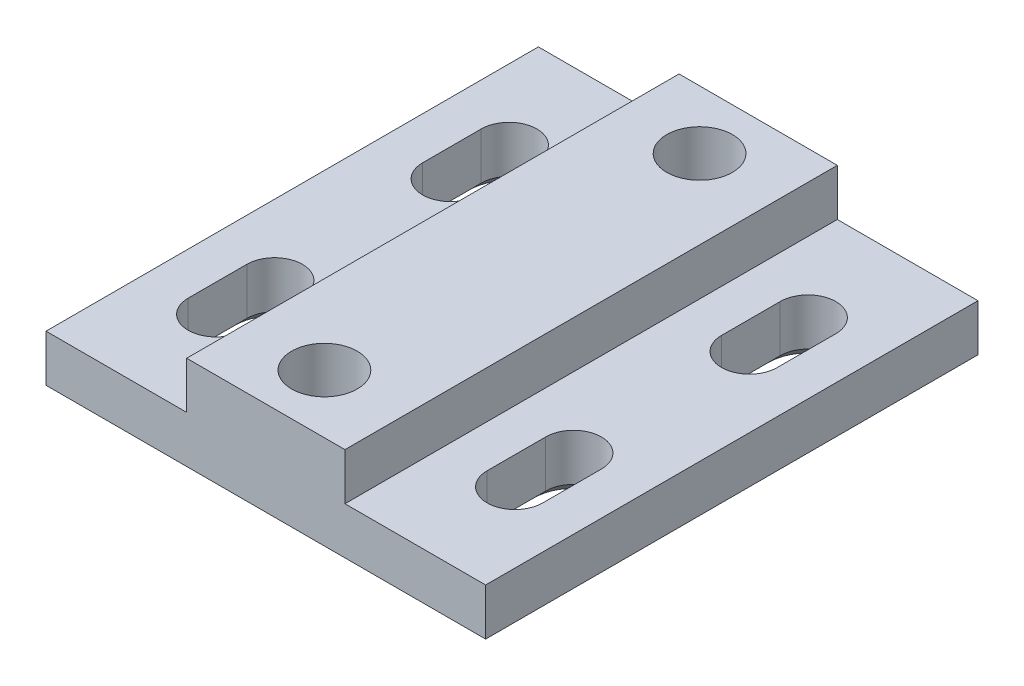
from build123d import *

# Parameters (mm, degrees)
ESBO_O1_W                = 12
ESBO_O1_H                = 42
ESBO_O1_W_2              = 13.5
ESBO_O1_R                = 2.8
RESSALTO_EXTRUS_O1_DEPTH = 5
CORTE_EXTRUS_O1_START    = -5
CORTE_EXTRUS_O1_DEPTH    = 4
RESSALTO_EXTRUS_O2_START = 5
ESBO_O1_3_W              = 13.5
ESBO_O1_3_H              = 42
ESBO_O1_3_R              = 2.8
RESSALTO_EXTRUS_O2_DEPTH = 4


with BuildPart() as part:
    # Esboço1 → Ressalto-extrusão1 (new body)
    # profile 1 of 3: a face of its own
    with BuildSketch(Plane(origin=(0, 0, 0), x_dir=(1, 0, 0), z_dir=(0, 1, 0))):
        with Locations((-12.75, 0)):
            Rectangle(ESBO_O1_W, ESBO_O1_H)
        with BuildLine():
            ThreePointArc((-10.375, -12.5), (-12.75, -14.875), (-15.125, -12.5))
            Line((-15.125, -12.5), (-15.125, -7.5))
            ThreePointArc((-15.125, -7.5), (-12.75, -5.125), (-10.375, -7.5))
            Line((-10.375, -7.5), (-10.375, -12.5))
        make_face(mode=Mode.SUBTRACT)
        with BuildLine():
            ThreePointArc((-10.375, 7.5), (-12.75, 5.125), (-15.125, 7.5))
            Line((-15.125, 7.5), (-15.125, 12.5))
            ThreePointArc((-15.125, 12.5), (-12.75, 14.875), (-10.375, 12.5))
            Line((-10.375, 12.5), (-10.375, 7.5))
        make_face(mode=Mode.SUBTRACT)
    # profile 2 of 3: a face of its own
    with BuildSketch(Plane(origin=(0, 0, 0), x_dir=(1, 0, 0), z_dir=(0, 1, 0))):
        Rectangle(ESBO_O1_W_2, ESBO_O1_H)
        with Locations(Location((0, -16, 0), (0, 0, 270))):
            Circle(ESBO_O1_R, mode=Mode.SUBTRACT)
        with Locations(Location((0, 16, 0), (0, 0, 270))):
            Circle(ESBO_O1_R, mode=Mode.SUBTRACT)
    # profile 3 of 3: a face of its own
    with BuildSketch(Plane(origin=(0, 0, 0), x_dir=(1, 0, 0), z_dir=(0, 1, 0))):
        with Locations((12.75, 0)):
            Rectangle(ESBO_O1_W, ESBO_O1_H)
        with BuildLine():
            Line((15.125, -7.5), (15.125, -12.5))
            ThreePointArc((15.125, -12.5), (12.75, -14.875), (10.375, -12.5))
            Line((10.375, -12.5), (10.375, -7.5))
            ThreePointArc((10.375, -7.5), (12.75, -5.125), (15.125, -7.5))
        make_face(mode=Mode.SUBTRACT)
        with BuildLine():
            Line((15.125, 12.5), (15.125, 7.5))
            ThreePointArc((15.125, 7.5), (12.75, 5.125), (10.375, 7.5))
            Line((10.375, 7.5), (10.375, 12.5))
            ThreePointArc((10.375, 12.5), (12.75, 14.875), (15.125, 12.5))
        make_face(mode=Mode.SUBTRACT)
    extrude(amount=RESSALTO_EXTRUS_O1_DEPTH)

    # Esboço2 → Corte-extrusão1 (cut)
    with BuildSketch(Plane(origin=(0, 5, 0), x_dir=(1, 0, 0), z_dir=(0, 1, 0)).offset(CORTE_EXTRUS_O1_START)):
        Polygon((5.022947342, 16), (2.511473671, 20.35), (-2.511473671, 20.35), (-5.022947342, 16), (-2.511473671, 11.65), (2.511473671, 11.65), align=None)
        Polygon((5.022947342, -16), (2.511473671, -11.65), (-2.511473671, -11.65), (-5.022947342, -16), (-2.511473671, -20.35), (2.511473671, -20.35), align=None)
    extrude(amount=CORTE_EXTRUS_O1_DEPTH, mode=Mode.SUBTRACT)

    # Esboço1<3> → Ressalto-extrusão2 (add)
    with BuildSketch(Plane(origin=(0, 0, 0), x_dir=(1, 0, 0), z_dir=(0, 1, 0)).offset(RESSALTO_EXTRUS_O2_START)):
        Rectangle(ESBO_O1_3_W, ESBO_O1_3_H)
        with Locations(Location((0, -16, 0), (0, 0, 270))):
            Circle(ESBO_O1_3_R, mode=Mode.SUBTRACT)
        with Locations(Location((0, 16, 0), (0, 0, 270))):
            Circle(ESBO_O1_3_R, mode=Mode.SUBTRACT)
    extrude(amount=RESSALTO_EXTRUS_O2_DEPTH)

    # Chanfro1
    # the kernel refuses this chamfer: 1 mm, written as the material it takes off along each edge
    with BuildSketch(Plane(origin=(12.75, 0, -7.5), x_dir=(1, 0, 0), z_dir=(0, 0, -1))) as chanfro1_piece_1:
        with BuildLine():
            Line((2.346715729, -1.028284271), (3.403284271, 0.028284271))
            Line((3.403284271, 0.028284271), (3.403284271, 0.048284271))
            ThreePointArc((3.403284271, 0.048284271), (2.889142136, 0.02), (2.375, 0.02))
            Line((2.375, 0.02), (2.355, 0))
            ThreePointArc((2.355, 0), (2.355, -0.514142136), (2.326715729, -1.028284271))
            Line((2.326715729, -1.028284271), (2.346715729, -1.028284271))
        make_face()
    revolve(axis=Axis((12.75, 0, -7.5), (0, -1, 0)), revolution_arc=180, mode=Mode.SUBTRACT)
    with BuildSketch(Plane(origin=(15.125, 0, -12.5), x_dir=(-0.02749587661058563, 0.9996219169112968, 0), z_dir=(0, 0, 1)), Plane(origin=(10.375, 0, -7.5), x_dir=(0.027495876610585623, 0.9996219169112968, 0), z_dir=(0, 0, -1)), Plane(origin=(15.125, 0, 7.5), x_dir=(-0.02749587661058563, 0.9996219169112968, 0), z_dir=(0, 0, 1)), Plane(origin=(10.375, 0, 12.5), x_dir=(0.02749587661058563, 0.9996219169112968, 0), z_dir=(0, 0, -1)), Plane(origin=(-15.125, 0, -7.5), x_dir=(0.02749587661058563, 0.9996219169112968, 0), z_dir=(0, 0, -1)), Plane(origin=(-10.375, 0, -12.5), x_dir=(-0.02749587661058563, 0.9996219169112968, 0), z_dir=(0, 0, 1)), Plane(origin=(-15.125, 0, 12.5), x_dir=(0.02749587661058563, 0.9996219169112968, 0), z_dir=(0, 0, -1)), Plane(origin=(-10.375, 0, 7.5), x_dir=(-0.02749587661058563, 0.9996219169112968, 0), z_dir=(0, 0, 1))) as chanfro1_piece_2:
        with BuildLine():
            Line((1.028673195, 0), (-0.056547155, -1.027117794))
            Line((-0.056547155, -1.027117794), (-0.076539593, -1.026567876))
            ThreePointArc((-0.076539593, -1.026567876), (-0.034129227, -0.51339783), (-0.019992438, 0.000549918))
            Line((-0.019992438, 0.000549918), (0.000549918, 0.019992438))
            ThreePointArc((0.000549918, 0.019992438), (0.514497665, 0.00585565), (1.029223113, 0.019992438))
            Line((1.029223113, 0.019992438), (1.028673195, 0))
        make_face()
    extrude(amount=5, mode=Mode.SUBTRACT)
    with BuildSketch(Plane(origin=(12.75, 0, -12.5), x_dir=(-1, 0, 0), z_dir=(0, 0, 1))) as chanfro1_piece_3:
        with BuildLine():
            Line((2.346715729, -1.028284271), (3.403284271, 0.028284271))
            Line((3.403284271, 0.028284271), (3.403284271, 0.048284271))
            ThreePointArc((3.403284271, 0.048284271), (2.889142136, 0.02), (2.375, 0.02))
            Line((2.375, 0.02), (2.355, 0))
            ThreePointArc((2.355, 0), (2.355, -0.514142136), (2.326715729, -1.028284271))
            Line((2.326715729, -1.028284271), (2.346715729, -1.028284271))
        make_face()
    revolve(axis=Axis((12.75, 0, -12.5), (0, -1, 0)), revolution_arc=180, mode=Mode.SUBTRACT)
    with BuildSketch(Plane(origin=(12.75, 0, 12.5), x_dir=(1, 0, 0), z_dir=(0, 0, -1))) as chanfro1_piece_4:
        with BuildLine():
            Line((2.346715729, -1.028284271), (3.403284271, 0.028284271))
            Line((3.403284271, 0.028284271), (3.403284271, 0.048284271))
            ThreePointArc((3.403284271, 0.048284271), (2.889142136, 0.02), (2.375, 0.02))
            Line((2.375, 0.02), (2.355, 0))
            ThreePointArc((2.355, 0), (2.355, -0.514142136), (2.326715729, -1.028284271))
            Line((2.326715729, -1.028284271), (2.346715729, -1.028284271))
        make_face()
    revolve(axis=Axis((12.75, 0, 12.5), (0, -1, 0)), revolution_arc=180, mode=Mode.SUBTRACT)
    with BuildSketch(Plane(origin=(12.75, 0, 7.5), x_dir=(-1, 0, 0), z_dir=(0, 0, 1))) as chanfro1_piece_5:
        with BuildLine():
            Line((2.346715729, -1.028284271), (3.403284271, 0.028284271))
            Line((3.403284271, 0.028284271), (3.403284271, 0.048284271))
            ThreePointArc((3.403284271, 0.048284271), (2.889142136, 0.02), (2.375, 0.02))
            Line((2.375, 0.02), (2.355, 0))
            ThreePointArc((2.355, 0), (2.355, -0.514142136), (2.326715729, -1.028284271))
            Line((2.326715729, -1.028284271), (2.346715729, -1.028284271))
        make_face()
    revolve(axis=Axis((12.75, 0, 7.5), (0, -1, 0)), revolution_arc=180, mode=Mode.SUBTRACT)
    with BuildSketch(Plane(origin=(-18.75, 0, -21), x_dir=(0.9996219169112968, -0.02749587661058639, 0), z_dir=(0, 0, 1))) as chanfro1_piece_6:
        with BuildLine():
            Line((1.028673195, 0), (-0.056547155, 1.027117794))
            Line((-0.056547155, 1.027117794), (-0.076539593, 1.026567876))
            ThreePointArc((-0.076539593, 1.026567876), (-0.034129227, 0.51339783), (-0.019992438, -0.000549918))
            Line((-0.019992438, -0.000549918), (0.000549918, -0.019992438))
            ThreePointArc((0.000549918, -0.019992438), (0.514497665, -0.00585565), (1.029223113, -0.019992438))
            Line((1.029223113, -0.019992438), (1.028673195, 0))
        make_face()
    extrude(amount=42, mode=Mode.SUBTRACT)
    with BuildSketch(Plane(origin=(18.75, 0, -21), x_dir=(0, 0.9996219169112968, -0.02749587661058908), z_dir=(-1, 0, 0))) as chanfro1_piece_7:
        with BuildLine():
            Line((1.028673195, 0), (-0.056547155, -1.027117794))
            Line((-0.056547155, -1.027117794), (-0.076539593, -1.026567876))
            ThreePointArc((-0.076539593, -1.026567876), (-0.034129227, -0.51339783), (-0.019992438, 0.000549918))
            Line((-0.019992438, 0.000549918), (0.000549918, 0.019992438))
            ThreePointArc((0.000549918, 0.019992438), (0.514497665, 0.00585565), (1.029223113, 0.019992438))
            Line((1.029223113, 0.019992438), (1.028673195, 0))
        make_face()
    extrude(amount=37.5, mode=Mode.SUBTRACT)
    with BuildSketch(Plane(origin=(18.75, 0, 21), x_dir=(0.02749587661058563, 0.9996219169112968, 0), z_dir=(0, 0, -1))) as chanfro1_piece_8:
        with BuildLine():
            Line((1.028673195, 0), (-0.056547155, -1.027117794))
            Line((-0.056547155, -1.027117794), (-0.076539593, -1.026567876))
            ThreePointArc((-0.076539593, -1.026567876), (-0.034129227, -0.51339783), (-0.019992438, 0.000549918))
            Line((-0.019992438, 0.000549918), (0.000549918, 0.019992438))
            ThreePointArc((0.000549918, 0.019992438), (0.514497665, 0.00585565), (1.029223113, 0.019992438))
            Line((1.029223113, 0.019992438), (1.028673195, 0))
        make_face()
    extrude(amount=42, mode=Mode.SUBTRACT)
    with BuildSketch(Plane(origin=(18.75, 0, 21), x_dir=(0, 0.9996219169112968, 0.02749587661058908), z_dir=(-1, 0, 0))) as chanfro1_piece_9:
        with BuildLine():
            Line((1.028673195, 0), (-0.056547155, 1.027117794))
            Line((-0.056547155, 1.027117794), (-0.076539593, 1.026567876))
            ThreePointArc((-0.076539593, 1.026567876), (-0.034129227, 0.51339783), (-0.019992438, -0.000549918))
            Line((-0.019992438, -0.000549918), (0.000549918, -0.019992438))
            ThreePointArc((0.000549918, -0.019992438), (0.514497665, -0.00585565), (1.029223113, -0.019992438))
            Line((1.029223113, -0.019992438), (1.028673195, 0))
        make_face()
    extrude(amount=37.5, mode=Mode.SUBTRACT)
    with BuildSketch(Plane(origin=(-12.75, 0, -7.5), x_dir=(1, 0, 0), z_dir=(0, 0, -1))) as chanfro1_piece_10:
        with BuildLine():
            Line((2.346715729, -1.028284271), (3.403284271, 0.028284271))
            Line((3.403284271, 0.028284271), (3.403284271, 0.048284271))
            ThreePointArc((3.403284271, 0.048284271), (2.889142136, 0.02), (2.375, 0.02))
            Line((2.375, 0.02), (2.355, 0))
            ThreePointArc((2.355, 0), (2.355, -0.514142136), (2.326715729, -1.028284271))
            Line((2.326715729, -1.028284271), (2.346715729, -1.028284271))
        make_face()
    revolve(axis=Axis((-12.75, 0, -7.5), (0, -1, 0)), revolution_arc=180, mode=Mode.SUBTRACT)
    with BuildSketch(Plane(origin=(-12.75, 0, -12.5), x_dir=(-1, 0, 0), z_dir=(0, 0, 1))) as chanfro1_piece_11:
        with BuildLine():
            Line((2.346715729, -1.028284271), (3.403284271, 0.028284271))
            Line((3.403284271, 0.028284271), (3.403284271, 0.048284271))
            ThreePointArc((3.403284271, 0.048284271), (2.889142136, 0.02), (2.375, 0.02))
            Line((2.375, 0.02), (2.355, 0))
            ThreePointArc((2.355, 0), (2.355, -0.514142136), (2.326715729, -1.028284271))
            Line((2.326715729, -1.028284271), (2.346715729, -1.028284271))
        make_face()
    revolve(axis=Axis((-12.75, 0, -12.5), (0, -1, 0)), revolution_arc=180, mode=Mode.SUBTRACT)
    with BuildSketch(Plane(origin=(-12.75, 0, 12.5), x_dir=(1, 0, 0), z_dir=(0, 0, -1))) as chanfro1_piece_12:
        with BuildLine():
            Line((2.346715729, -1.028284271), (3.403284271, 0.028284271))
            Line((3.403284271, 0.028284271), (3.403284271, 0.048284271))
            ThreePointArc((3.403284271, 0.048284271), (2.889142136, 0.02), (2.375, 0.02))
            Line((2.375, 0.02), (2.355, 0))
            ThreePointArc((2.355, 0), (2.355, -0.514142136), (2.326715729, -1.028284271))
            Line((2.326715729, -1.028284271), (2.346715729, -1.028284271))
        make_face()
    revolve(axis=Axis((-12.75, 0, 12.5), (0, -1, 0)), revolution_arc=180, mode=Mode.SUBTRACT)
    with BuildSketch(Plane(origin=(-12.75, 0, 7.5), x_dir=(-1, 0, 0), z_dir=(0, 0, 1))) as chanfro1_piece_13:
        with BuildLine():
            Line((2.346715729, -1.028284271), (3.403284271, 0.028284271))
            Line((3.403284271, 0.028284271), (3.403284271, 0.048284271))
            ThreePointArc((3.403284271, 0.048284271), (2.889142136, 0.02), (2.375, 0.02))
            Line((2.375, 0.02), (2.355, 0))
            ThreePointArc((2.355, 0), (2.355, -0.514142136), (2.326715729, -1.028284271))
            Line((2.326715729, -1.028284271), (2.346715729, -1.028284271))
        make_face()
    revolve(axis=Axis((-12.75, 0, 7.5), (0, -1, 0)), revolution_arc=180, mode=Mode.SUBTRACT)
    with BuildSketch(Plane(origin=(1.225632177, 0, -9.422857202), x_dir=(-0.023812127644089888, 0.9996219169112968, -0.013747938305293013), z_dir=(0.4999999999999996, 0, -0.8660254037844389))) as chanfro1_piece_14_section:
        with BuildLine():
            Line((1.028673195, 0), (-0.056547155, 1.027117794))
            Line((-0.056547155, 1.027117794), (-0.076539593, 1.026567876))
            ThreePointArc((-0.076539593, 1.026567876), (-0.034129227, 0.51339783), (-0.019992438, -0.000549918))
            Line((-0.019992438, -0.000549918), (0.000549918, -0.019992438))
            ThreePointArc((0.000549918, -0.019992438), (0.514497665, -0.00585565), (1.029223113, -0.019992438))
            Line((1.029223113, -0.019992438), (1.028673195, 0))
        make_face()
    chanfro1_piece_14 = extrude(amount=10.166313318, mode=Mode.PRIVATE)
    chanfro1_piece_14 = split(chanfro1_piece_14, bisect_by=Plane(origin=(4.039140565, 0.338238152, -11.65), z_dir=(0, 0, -1)), keep=Keep.TOP, mode=Mode.PRIVATE)
    chanfro1_piece_14 = split(chanfro1_piece_14, bisect_by=Plane(origin=(5.786780789, 0.338238152, -14.677001661), z_dir=(-0.8660254037844387, 0, 0.49999999999999994)), keep=Keep.TOP, mode=Mode.PRIVATE)
    add(chanfro1_piece_14, mode=Mode.SUBTRACT)
    with BuildSketch(Plane(origin=(6.308788836, 0, -13.772857202), x_dir=(-0.023812127644089725, 0.9996219169112968, 0.01374793830529293), z_dir=(-0.49999999999999994, 0, -0.8660254037844387))) as chanfro1_piece_15_section:
        with BuildLine():
            Line((1.028673195, 0), (-0.056547155, 1.027117794))
            Line((-0.056547155, 1.027117794), (-0.076539593, 1.026567876))
            ThreePointArc((-0.076539593, 1.026567876), (-0.034129227, 0.51339783), (-0.019992438, -0.000549918))
            Line((-0.019992438, -0.000549918), (0.000549918, -0.019992438))
            ThreePointArc((0.000549918, -0.019992438), (0.514497665, -0.00585565), (1.029223113, -0.019992438))
            Line((1.029223113, -0.019992438), (1.028673195, 0))
        make_face()
    chanfro1_piece_15 = extrude(amount=10.166313318, mode=Mode.PRIVATE)
    chanfro1_piece_15 = split(chanfro1_piece_15, bisect_by=Plane(origin=(4.039140565, 0.338238152, -20.35), z_dir=(0, 0, 1)), keep=Keep.TOP, mode=Mode.PRIVATE)
    chanfro1_piece_15 = split(chanfro1_piece_15, bisect_by=Plane(origin=(5.786780789, 0.338238152, -17.322998339), z_dir=(-0.8660254037844389, 0, -0.4999999999999996)), keep=Keep.TOP, mode=Mode.PRIVATE)
    add(chanfro1_piece_15, mode=Mode.SUBTRACT)
    with BuildSketch(Plane(origin=(5.083156659, 0, -20.35), x_dir=(0, 0.9996219169112968, 0.02749587661058563), z_dir=(-1, 0, 0))) as chanfro1_piece_16_section:
        with BuildLine():
            Line((1.028673195, 0), (-0.056547155, 1.027117794))
            Line((-0.056547155, 1.027117794), (-0.076539593, 1.026567876))
            ThreePointArc((-0.076539593, 1.026567876), (-0.034129227, 0.51339783), (-0.019992438, -0.000549918))
            Line((-0.019992438, -0.000549918), (0.000549918, -0.019992438))
            ThreePointArc((0.000549918, -0.019992438), (0.514497665, -0.00585565), (1.029223113, -0.019992438))
            Line((1.029223113, -0.019992438), (1.028673195, 0))
        make_face()
    chanfro1_piece_16 = extrude(amount=10.166313318, mode=Mode.PRIVATE)
    chanfro1_piece_16 = split(chanfro1_piece_16, bisect_by=Plane(origin=(-1.747640224, 0.338238152, -21.672998339), z_dir=(0.8660254037844389, 0, 0.49999999999999967)), keep=Keep.TOP, mode=Mode.PRIVATE)
    chanfro1_piece_16 = split(chanfro1_piece_16, bisect_by=Plane(origin=(1.747640224, 0.338238152, -21.672998339), z_dir=(-0.8660254037844387, 0, 0.49999999999999994)), keep=Keep.TOP, mode=Mode.PRIVATE)
    add(chanfro1_piece_16, mode=Mode.SUBTRACT)
    with BuildSketch(Plane(origin=(-1.225632177, 0, -22.577142798), x_dir=(0.023812127644090766, 0.9996219169112968, 0.013747938305293517), z_dir=(-0.49999999999999967, 0, 0.8660254037844389))) as chanfro1_piece_17_section:
        with BuildLine():
            Line((1.028673195, 0), (-0.056547155, 1.027117794))
            Line((-0.056547155, 1.027117794), (-0.076539593, 1.026567876))
            ThreePointArc((-0.076539593, 1.026567876), (-0.034129227, 0.51339783), (-0.019992438, -0.000549918))
            Line((-0.019992438, -0.000549918), (0.000549918, -0.019992438))
            ThreePointArc((0.000549918, -0.019992438), (0.514497665, -0.00585565), (1.029223113, -0.019992438))
            Line((1.029223113, -0.019992438), (1.028673195, 0))
        make_face()
    chanfro1_piece_17 = extrude(amount=10.166313318, mode=Mode.PRIVATE)
    chanfro1_piece_17 = split(chanfro1_piece_17, bisect_by=Plane(origin=(-5.786780789, 0.338238152, -17.322998339), z_dir=(0.8660254037844387, 0, -0.5000000000000001)), keep=Keep.TOP, mode=Mode.PRIVATE)
    chanfro1_piece_17 = split(chanfro1_piece_17, bisect_by=Plane(origin=(-4.039140565, 0.338238152, -20.35), z_dir=(0, 0, 1)), keep=Keep.TOP, mode=Mode.PRIVATE)
    add(chanfro1_piece_17, mode=Mode.SUBTRACT)
    with BuildSketch(Plane(origin=(-6.308788836, 0, -18.227142798), x_dir=(0.02381212764409112, 0.9996219169112968, -0.01374793830529374), z_dir=(0.5000000000000001, 0, 0.8660254037844387))) as chanfro1_piece_18_section:
        with BuildLine():
            Line((1.028673195, 0), (-0.056547155, 1.027117794))
            Line((-0.056547155, 1.027117794), (-0.076539593, 1.026567876))
            ThreePointArc((-0.076539593, 1.026567876), (-0.034129227, 0.51339783), (-0.019992438, -0.000549918))
            Line((-0.019992438, -0.000549918), (0.000549918, -0.019992438))
            ThreePointArc((0.000549918, -0.019992438), (0.514497665, -0.00585565), (1.029223113, -0.019992438))
            Line((1.029223113, -0.019992438), (1.028673195, 0))
        make_face()
    chanfro1_piece_18 = extrude(amount=10.166313318, mode=Mode.PRIVATE)
    chanfro1_piece_18 = split(chanfro1_piece_18, bisect_by=Plane(origin=(-5.786780789, 0.338238152, -14.677001661), z_dir=(0.8660254037844389, 0, 0.49999999999999967)), keep=Keep.TOP, mode=Mode.PRIVATE)
    chanfro1_piece_18 = split(chanfro1_piece_18, bisect_by=Plane(origin=(-4.039140565, 0.338238152, -11.65), z_dir=(0, 0, -1)), keep=Keep.TOP, mode=Mode.PRIVATE)
    add(chanfro1_piece_18, mode=Mode.SUBTRACT)
    with BuildSketch(Plane(origin=(-5.083156659, 0, -11.65), x_dir=(0, 0.9996219169112968, -0.02749587661058563), z_dir=(1, 0, 0))) as chanfro1_piece_19_section:
        with BuildLine():
            Line((1.028673195, 0), (-0.056547155, 1.027117794))
            Line((-0.056547155, 1.027117794), (-0.076539593, 1.026567876))
            ThreePointArc((-0.076539593, 1.026567876), (-0.034129227, 0.51339783), (-0.019992438, -0.000549918))
            Line((-0.019992438, -0.000549918), (0.000549918, -0.019992438))
            ThreePointArc((0.000549918, -0.019992438), (0.514497665, -0.00585565), (1.029223113, -0.019992438))
            Line((1.029223113, -0.019992438), (1.028673195, 0))
        make_face()
    chanfro1_piece_19 = extrude(amount=10.166313318, mode=Mode.PRIVATE)
    chanfro1_piece_19 = split(chanfro1_piece_19, bisect_by=Plane(origin=(-1.747640224, 0.338238152, -10.327001661), z_dir=(0.8660254037844387, 0, -0.5000000000000001)), keep=Keep.TOP, mode=Mode.PRIVATE)
    chanfro1_piece_19 = split(chanfro1_piece_19, bisect_by=Plane(origin=(1.747640224, 0.338238152, -10.327001661), z_dir=(-0.8660254037844389, 0, -0.4999999999999996)), keep=Keep.TOP, mode=Mode.PRIVATE)
    add(chanfro1_piece_19, mode=Mode.SUBTRACT)
    with BuildSketch(Plane(origin=(1.225632177, 0, 22.577142798), x_dir=(-0.023812127644090318, 0.9996219169112968, -0.013747938305293254), z_dir=(0.49999999999999944, 0, -0.866025403784439))) as chanfro1_piece_20_section:
        with BuildLine():
            Line((1.028673195, 0), (-0.056547155, 1.027117794))
            Line((-0.056547155, 1.027117794), (-0.076539593, 1.026567876))
            ThreePointArc((-0.076539593, 1.026567876), (-0.034129227, 0.51339783), (-0.019992438, -0.000549918))
            Line((-0.019992438, -0.000549918), (0.000549918, -0.019992438))
            ThreePointArc((0.000549918, -0.019992438), (0.514497665, -0.00585565), (1.029223113, -0.019992438))
            Line((1.029223113, -0.019992438), (1.028673195, 0))
        make_face()
    chanfro1_piece_20 = extrude(amount=10.166313318, mode=Mode.PRIVATE)
    chanfro1_piece_20 = split(chanfro1_piece_20, bisect_by=Plane(origin=(4.039140565, 0.338238152, 20.35), z_dir=(0, 0, -1)), keep=Keep.TOP, mode=Mode.PRIVATE)
    chanfro1_piece_20 = split(chanfro1_piece_20, bisect_by=Plane(origin=(5.786780789, 0.338238152, 17.322998339), z_dir=(-0.8660254037844387, 0, 0.5000000000000003)), keep=Keep.TOP, mode=Mode.PRIVATE)
    add(chanfro1_piece_20, mode=Mode.SUBTRACT)
    with BuildSketch(Plane(origin=(6.308788836, 0, 18.227142798), x_dir=(-0.02381212764409067, 0.9996219169112968, 0.013747938305293488), z_dir=(-0.5000000000000003, 0, -0.8660254037844386))) as chanfro1_piece_21_section:
        with BuildLine():
            Line((1.028673195, 0), (-0.056547155, 1.027117794))
            Line((-0.056547155, 1.027117794), (-0.076539593, 1.026567876))
            ThreePointArc((-0.076539593, 1.026567876), (-0.034129227, 0.51339783), (-0.019992438, -0.000549918))
            Line((-0.019992438, -0.000549918), (0.000549918, -0.019992438))
            ThreePointArc((0.000549918, -0.019992438), (0.514497665, -0.00585565), (1.029223113, -0.019992438))
            Line((1.029223113, -0.019992438), (1.028673195, 0))
        make_face()
    chanfro1_piece_21 = extrude(amount=10.166313318, mode=Mode.PRIVATE)
    chanfro1_piece_21 = split(chanfro1_piece_21, bisect_by=Plane(origin=(4.039140565, 0.338238152, 11.65), z_dir=(0, 0, 1)), keep=Keep.TOP, mode=Mode.PRIVATE)
    chanfro1_piece_21 = split(chanfro1_piece_21, bisect_by=Plane(origin=(5.786780789, 0.338238152, 14.677001661), z_dir=(-0.866025403784439, 0, -0.49999999999999944)), keep=Keep.TOP, mode=Mode.PRIVATE)
    add(chanfro1_piece_21, mode=Mode.SUBTRACT)
    with BuildSketch(Plane(origin=(5.083156659, 0, 11.65), x_dir=(0, 0.9996219169112968, 0.02749587661058563), z_dir=(-1, 0, 0))) as chanfro1_piece_22_section:
        with BuildLine():
            Line((1.028673195, 0), (-0.056547155, 1.027117794))
            Line((-0.056547155, 1.027117794), (-0.076539593, 1.026567876))
            ThreePointArc((-0.076539593, 1.026567876), (-0.034129227, 0.51339783), (-0.019992438, -0.000549918))
            Line((-0.019992438, -0.000549918), (0.000549918, -0.019992438))
            ThreePointArc((0.000549918, -0.019992438), (0.514497665, -0.00585565), (1.029223113, -0.019992438))
            Line((1.029223113, -0.019992438), (1.028673195, 0))
        make_face()
    chanfro1_piece_22 = extrude(amount=10.166313318, mode=Mode.PRIVATE)
    chanfro1_piece_22 = split(chanfro1_piece_22, bisect_by=Plane(origin=(-1.747640224, 0.338238152, 10.327001661), z_dir=(0.8660254037844387, 0, 0.5000000000000001)), keep=Keep.TOP, mode=Mode.PRIVATE)
    chanfro1_piece_22 = split(chanfro1_piece_22, bisect_by=Plane(origin=(1.747640224, 0.338238152, 10.327001661), z_dir=(-0.8660254037844387, 0, 0.5000000000000003)), keep=Keep.TOP, mode=Mode.PRIVATE)
    add(chanfro1_piece_22, mode=Mode.SUBTRACT)
    with BuildSketch(Plane(origin=(-1.225632177, 0, 9.422857202), x_dir=(0.023812127644089787, 0.9996219169112968, 0.01374793830529297), z_dir=(-0.5000000000000001, 0, 0.8660254037844387))) as chanfro1_piece_23_section:
        with BuildLine():
            Line((1.028673195, 0), (-0.056547155, 1.027117794))
            Line((-0.056547155, 1.027117794), (-0.076539593, 1.026567876))
            ThreePointArc((-0.076539593, 1.026567876), (-0.034129227, 0.51339783), (-0.019992438, -0.000549918))
            Line((-0.019992438, -0.000549918), (0.000549918, -0.019992438))
            ThreePointArc((0.000549918, -0.019992438), (0.514497665, -0.00585565), (1.029223113, -0.019992438))
            Line((1.029223113, -0.019992438), (1.028673195, 0))
        make_face()
    chanfro1_piece_23 = extrude(amount=10.166313318, mode=Mode.PRIVATE)
    chanfro1_piece_23 = split(chanfro1_piece_23, bisect_by=Plane(origin=(-5.786780789, 0.338238152, 14.677001661), z_dir=(0.8660254037844388, 0, -0.4999999999999998)), keep=Keep.TOP, mode=Mode.PRIVATE)
    chanfro1_piece_23 = split(chanfro1_piece_23, bisect_by=Plane(origin=(-4.039140565, 0.338238152, 11.65), z_dir=(0, 0, 1)), keep=Keep.TOP, mode=Mode.PRIVATE)
    add(chanfro1_piece_23, mode=Mode.SUBTRACT)
    with BuildSketch(Plane(origin=(-6.308788836, 0, 13.772857202), x_dir=(0.023812127644090478, 0.9996219169112968, -0.013747938305293358), z_dir=(0.4999999999999998, 0, 0.8660254037844388))) as chanfro1_piece_24_section:
        with BuildLine():
            Line((1.028673195, 0), (-0.056547155, 1.027117794))
            Line((-0.056547155, 1.027117794), (-0.076539593, 1.026567876))
            ThreePointArc((-0.076539593, 1.026567876), (-0.034129227, 0.51339783), (-0.019992438, -0.000549918))
            Line((-0.019992438, -0.000549918), (0.000549918, -0.019992438))
            ThreePointArc((0.000549918, -0.019992438), (0.514497665, -0.00585565), (1.029223113, -0.019992438))
            Line((1.029223113, -0.019992438), (1.028673195, 0))
        make_face()
    chanfro1_piece_24 = extrude(amount=10.166313318, mode=Mode.PRIVATE)
    chanfro1_piece_24 = split(chanfro1_piece_24, bisect_by=Plane(origin=(-5.786780789, 0.338238152, 17.322998339), z_dir=(0.8660254037844387, 0, 0.5000000000000001)), keep=Keep.TOP, mode=Mode.PRIVATE)
    chanfro1_piece_24 = split(chanfro1_piece_24, bisect_by=Plane(origin=(-4.039140565, 0.338238152, 20.35), z_dir=(0, 0, -1)), keep=Keep.TOP, mode=Mode.PRIVATE)
    add(chanfro1_piece_24, mode=Mode.SUBTRACT)
    with BuildSketch(Plane(origin=(-5.083156659, 0, 20.35), x_dir=(0, 0.9996219169112968, -0.02749587661058563), z_dir=(1, 0, 0))) as chanfro1_piece_25_section:
        with BuildLine():
            Line((1.028673195, 0), (-0.056547155, 1.027117794))
            Line((-0.056547155, 1.027117794), (-0.076539593, 1.026567876))
            ThreePointArc((-0.076539593, 1.026567876), (-0.034129227, 0.51339783), (-0.019992438, -0.000549918))
            Line((-0.019992438, -0.000549918), (0.000549918, -0.019992438))
            ThreePointArc((0.000549918, -0.019992438), (0.514497665, -0.00585565), (1.029223113, -0.019992438))
            Line((1.029223113, -0.019992438), (1.028673195, 0))
        make_face()
    chanfro1_piece_25 = extrude(amount=10.166313318, mode=Mode.PRIVATE)
    chanfro1_piece_25 = split(chanfro1_piece_25, bisect_by=Plane(origin=(-1.747640224, 0.338238152, 21.672998339), z_dir=(0.8660254037844388, 0, -0.4999999999999998)), keep=Keep.TOP, mode=Mode.PRIVATE)
    chanfro1_piece_25 = split(chanfro1_piece_25, bisect_by=Plane(origin=(1.747640224, 0.338238152, 21.672998339), z_dir=(-0.866025403784439, 0, -0.49999999999999944)), keep=Keep.TOP, mode=Mode.PRIVATE)
    add(chanfro1_piece_25, mode=Mode.SUBTRACT)
    with BuildSketch(Plane(origin=(18.75, 0, -21), x_dir=(0, 0.9996219169112968, -0.02749587661058908), z_dir=(-1, 0, 0))) as chanfro1_piece_26a_section:
        with BuildLine():
            Line((1.028673195, 0), (-0.056547155, -1.027117794))
            Line((-0.056547155, -1.027117794), (-0.076539593, -1.026567876))
            ThreePointArc((-0.076539593, -1.026567876), (-0.034129227, -0.51339783), (-0.019992438, 0.000549918))
            Line((-0.019992438, 0.000549918), (0.000549918, 0.019992438))
            ThreePointArc((0.000549918, 0.019992438), (0.514497665, 0.00585565), (1.029223113, 0.019992438))
            Line((1.029223113, 0.019992438), (1.028673195, 0))
        make_face()
    chanfro1_piece_26a = extrude(amount=40.071682988, mode=Mode.PRIVATE)
    chanfro1_piece_26a = split(chanfro1_piece_26a, bisect_by=Plane(origin=(-18.75, 0.329793627, -20.670206373), z_dir=(-1, 0, 0)), keep=Keep.TOP, mode=Mode.PRIVATE)
    with BuildSketch(Plane(origin=(-18.75, 0, -23.571682988), x_dir=(0.9996219169112968, -0.02749587661058639, 0), z_dir=(0, 0, 1))) as chanfro1_piece_26b_section:
        with BuildLine():
            Line((1.028673195, 0), (-0.056547155, 1.027117794))
            Line((-0.056547155, 1.027117794), (-0.076539593, 1.026567876))
            ThreePointArc((-0.076539593, 1.026567876), (-0.034129227, 0.51339783), (-0.019992438, -0.000549918))
            Line((-0.019992438, -0.000549918), (0.000549918, -0.019992438))
            ThreePointArc((0.000549918, -0.019992438), (0.514497665, -0.00585565), (1.029223113, -0.019992438))
            Line((1.029223113, -0.019992438), (1.028673195, 0))
        make_face()
    chanfro1_piece_26b = extrude(amount=44.571682988, mode=Mode.PRIVATE)
    chanfro1_piece_26b = split(chanfro1_piece_26b, bisect_by=Plane(origin=(-18.420206373, 0.329793627, -21), z_dir=(0, 0, -1)), keep=Keep.TOP, mode=Mode.PRIVATE)
    chanfro1_piece_26 = chanfro1_piece_26a & chanfro1_piece_26b
    add(chanfro1_piece_26, mode=Mode.SUBTRACT)
    with BuildSketch(Plane(origin=(18.75, 0, 21), x_dir=(0, 0.9996219169112968, 0.02749587661058908), z_dir=(-1, 0, 0))) as chanfro1_piece_27a_section:
        with BuildLine():
            Line((1.028673195, 0), (-0.056547155, 1.027117794))
            Line((-0.056547155, 1.027117794), (-0.076539593, 1.026567876))
            ThreePointArc((-0.076539593, 1.026567876), (-0.034129227, 0.51339783), (-0.019992438, -0.000549918))
            Line((-0.019992438, -0.000549918), (0.000549918, -0.019992438))
            ThreePointArc((0.000549918, -0.019992438), (0.514497665, -0.00585565), (1.029223113, -0.019992438))
            Line((1.029223113, -0.019992438), (1.028673195, 0))
        make_face()
    chanfro1_piece_27a = extrude(amount=40.071682988, mode=Mode.PRIVATE)
    chanfro1_piece_27a = split(chanfro1_piece_27a, bisect_by=Plane(origin=(-18.75, 0.329793627, 20.670206373), z_dir=(-1, 0, 0)), keep=Keep.TOP, mode=Mode.PRIVATE)
    with BuildSketch(Plane(origin=(-18.75, 0, -21), x_dir=(0.9996219169112968, -0.02749587661058639, 0), z_dir=(0, 0, 1))) as chanfro1_piece_27b_section:
        with BuildLine():
            Line((1.028673195, 0), (-0.056547155, 1.027117794))
            Line((-0.056547155, 1.027117794), (-0.076539593, 1.026567876))
            ThreePointArc((-0.076539593, 1.026567876), (-0.034129227, 0.51339783), (-0.019992438, -0.000549918))
            Line((-0.019992438, -0.000549918), (0.000549918, -0.019992438))
            ThreePointArc((0.000549918, -0.019992438), (0.514497665, -0.00585565), (1.029223113, -0.019992438))
            Line((1.029223113, -0.019992438), (1.028673195, 0))
        make_face()
    chanfro1_piece_27b = extrude(amount=44.571682988, mode=Mode.PRIVATE)
    chanfro1_piece_27b = split(chanfro1_piece_27b, bisect_by=Plane(origin=(-18.420206373, 0.329793627, 21), z_dir=(0, 0, 1)), keep=Keep.TOP, mode=Mode.PRIVATE)
    chanfro1_piece_27 = chanfro1_piece_27a & chanfro1_piece_27b
    add(chanfro1_piece_27, mode=Mode.SUBTRACT)
    with BuildSketch(Plane(origin=(21.321682988, 0, -21), x_dir=(0, 0.9996219169112968, -0.02749587661058563), z_dir=(-1, 0, 0))) as chanfro1_piece_28a_section:
        with BuildLine():
            Line((1.028673195, 0), (-0.056547155, -1.027117794))
            Line((-0.056547155, -1.027117794), (-0.076539593, -1.026567876))
            ThreePointArc((-0.076539593, -1.026567876), (-0.034129227, -0.51339783), (-0.019992438, 0.000549918))
            Line((-0.019992438, 0.000549918), (0.000549918, 0.019992438))
            ThreePointArc((0.000549918, 0.019992438), (0.514497665, 0.00585565), (1.029223113, 0.019992438))
            Line((1.029223113, 0.019992438), (1.028673195, 0))
        make_face()
    chanfro1_piece_28a = extrude(amount=40.071682988, mode=Mode.PRIVATE)
    chanfro1_piece_28a = split(chanfro1_piece_28a, bisect_by=Plane(origin=(18.75, 0.329793627, -20.670206373), z_dir=(1, 0, 0)), keep=Keep.TOP, mode=Mode.PRIVATE)
    with BuildSketch(Plane(origin=(18.75, 0, 21), x_dir=(0.02749587661058563, 0.9996219169112968, 0), z_dir=(0, 0, -1))) as chanfro1_piece_28b_section:
        with BuildLine():
            Line((1.028673195, 0), (-0.056547155, -1.027117794))
            Line((-0.056547155, -1.027117794), (-0.076539593, -1.026567876))
            ThreePointArc((-0.076539593, -1.026567876), (-0.034129227, -0.51339783), (-0.019992438, 0.000549918))
            Line((-0.019992438, 0.000549918), (0.000549918, 0.019992438))
            ThreePointArc((0.000549918, 0.019992438), (0.514497665, 0.00585565), (1.029223113, 0.019992438))
            Line((1.029223113, 0.019992438), (1.028673195, 0))
        make_face()
    chanfro1_piece_28b = extrude(amount=44.571682988, mode=Mode.PRIVATE)
    chanfro1_piece_28b = split(chanfro1_piece_28b, bisect_by=Plane(origin=(18.420206373, 0.329793627, -21), z_dir=(0, 0, -1)), keep=Keep.TOP, mode=Mode.PRIVATE)
    chanfro1_piece_28 = chanfro1_piece_28a & chanfro1_piece_28b
    add(chanfro1_piece_28, mode=Mode.SUBTRACT)
    with BuildSketch(Plane(origin=(21.321682988, 0, 21), x_dir=(0, 0.9996219169112968, 0.02749587661058563), z_dir=(-1, 0, 0))) as chanfro1_piece_29a_section:
        with BuildLine():
            Line((1.028673195, 0), (-0.056547155, 1.027117794))
            Line((-0.056547155, 1.027117794), (-0.076539593, 1.026567876))
            ThreePointArc((-0.076539593, 1.026567876), (-0.034129227, 0.51339783), (-0.019992438, -0.000549918))
            Line((-0.019992438, -0.000549918), (0.000549918, -0.019992438))
            ThreePointArc((0.000549918, -0.019992438), (0.514497665, -0.00585565), (1.029223113, -0.019992438))
            Line((1.029223113, -0.019992438), (1.028673195, 0))
        make_face()
    chanfro1_piece_29a = extrude(amount=40.071682988, mode=Mode.PRIVATE)
    chanfro1_piece_29a = split(chanfro1_piece_29a, bisect_by=Plane(origin=(18.75, 0.329793627, 20.670206373), z_dir=(1, 0, 0)), keep=Keep.TOP, mode=Mode.PRIVATE)
    with BuildSketch(Plane(origin=(18.75, 0, 23.571682988), x_dir=(0.02749587661058563, 0.9996219169112968, 0), z_dir=(0, 0, -1))) as chanfro1_piece_29b_section:
        with BuildLine():
            Line((1.028673195, 0), (-0.056547155, -1.027117794))
            Line((-0.056547155, -1.027117794), (-0.076539593, -1.026567876))
            ThreePointArc((-0.076539593, -1.026567876), (-0.034129227, -0.51339783), (-0.019992438, 0.000549918))
            Line((-0.019992438, 0.000549918), (0.000549918, 0.019992438))
            ThreePointArc((0.000549918, 0.019992438), (0.514497665, 0.00585565), (1.029223113, 0.019992438))
            Line((1.029223113, 0.019992438), (1.028673195, 0))
        make_face()
    chanfro1_piece_29b = extrude(amount=44.571682988, mode=Mode.PRIVATE)
    chanfro1_piece_29b = split(chanfro1_piece_29b, bisect_by=Plane(origin=(18.420206373, 0.329793627, 21), z_dir=(0, 0, 1)), keep=Keep.TOP, mode=Mode.PRIVATE)
    chanfro1_piece_29 = chanfro1_piece_29a & chanfro1_piece_29b
    add(chanfro1_piece_29, mode=Mode.SUBTRACT)
    with BuildSketch(Plane(origin=(-5.083156659, 0, -11.65), x_dir=(0, 0.9996219169112968, -0.02749587661058563), z_dir=(1, 0, 0))) as chanfro1_piece_30a_section:
        with BuildLine():
            Line((1.028673195, 0), (-0.056547155, 1.027117794))
            Line((-0.056547155, 1.027117794), (-0.076539593, 1.026567876))
            ThreePointArc((-0.076539593, 1.026567876), (-0.034129227, 0.51339783), (-0.019992438, -0.000549918))
            Line((-0.019992438, -0.000549918), (0.000549918, -0.019992438))
            ThreePointArc((0.000549918, -0.019992438), (0.514497665, -0.00585565), (1.029223113, -0.019992438))
            Line((1.029223113, -0.019992438), (1.028673195, 0))
        make_face()
    chanfro1_piece_30a = extrude(amount=10.166313318, mode=Mode.PRIVATE)
    chanfro1_piece_30a = split(chanfro1_piece_30a, bisect_by=Plane(origin=(2.659622771, 0.322697437, -11.906601768), z_dir=(0.8660254037844389, 0, 0.4999999999999996)), keep=Keep.TOP, mode=Mode.PRIVATE)
    with BuildSketch(Plane(origin=(1.225632177, 0, -9.422857202), x_dir=(-0.023812127644089888, 0.9996219169112968, -0.013747938305293013), z_dir=(0.4999999999999996, 0, -0.8660254037844389))) as chanfro1_piece_30b_section:
        with BuildLine():
            Line((1.028673195, 0), (-0.056547155, 1.027117794))
            Line((-0.056547155, 1.027117794), (-0.076539593, 1.026567876))
            ThreePointArc((-0.076539593, 1.026567876), (-0.034129227, 0.51339783), (-0.019992438, -0.000549918))
            Line((-0.019992438, -0.000549918), (0.000549918, -0.019992438))
            ThreePointArc((0.000549918, -0.019992438), (0.514497665, -0.00585565), (1.029223113, -0.019992438))
            Line((1.029223113, -0.019992438), (1.028673195, 0))
        make_face()
    chanfro1_piece_30b = extrude(amount=10.166313318, mode=Mode.PRIVATE)
    chanfro1_piece_30b = split(chanfro1_piece_30b, bisect_by=Plane(origin=(2.215175471, 0.322697437, -11.65), z_dir=(0, 0, 1)), keep=Keep.TOP, mode=Mode.PRIVATE)
    chanfro1_piece_30 = chanfro1_piece_30a & chanfro1_piece_30b
    add(chanfro1_piece_30, mode=Mode.SUBTRACT)
    with BuildSketch(Plane(origin=(1.225632177, 0, -9.422857202), x_dir=(-0.023812127644089888, 0.9996219169112968, -0.013747938305293013), z_dir=(0.4999999999999996, 0, -0.8660254037844389))) as chanfro1_piece_31a_section:
        with BuildLine():
            Line((1.028673195, 0), (-0.056547155, 1.027117794))
            Line((-0.056547155, 1.027117794), (-0.076539593, 1.026567876))
            ThreePointArc((-0.076539593, 1.026567876), (-0.034129227, 0.51339783), (-0.019992438, -0.000549918))
            Line((-0.019992438, -0.000549918), (0.000549918, -0.019992438))
            ThreePointArc((0.000549918, -0.019992438), (0.514497665, -0.00585565), (1.029223113, -0.019992438))
            Line((1.029223113, -0.019992438), (1.028673195, 0))
        make_face()
    chanfro1_piece_31a = extrude(amount=10.166313318, mode=Mode.PRIVATE)
    chanfro1_piece_31a = split(chanfro1_piece_31a, bisect_by=Plane(origin=(4.874798242, 0.322697437, -16.256601768), z_dir=(0.8660254037844387, 0, -0.49999999999999994)), keep=Keep.TOP, mode=Mode.PRIVATE)
    with BuildSketch(Plane(origin=(6.308788836, 0, -13.772857202), x_dir=(-0.023812127644089725, 0.9996219169112968, 0.01374793830529293), z_dir=(-0.49999999999999994, 0, -0.8660254037844387))) as chanfro1_piece_31b_section:
        with BuildLine():
            Line((1.028673195, 0), (-0.056547155, 1.027117794))
            Line((-0.056547155, 1.027117794), (-0.076539593, 1.026567876))
            ThreePointArc((-0.076539593, 1.026567876), (-0.034129227, 0.51339783), (-0.019992438, -0.000549918))
            Line((-0.019992438, -0.000549918), (0.000549918, -0.019992438))
            ThreePointArc((0.000549918, -0.019992438), (0.514497665, -0.00585565), (1.029223113, -0.019992438))
            Line((1.029223113, -0.019992438), (1.028673195, 0))
        make_face()
    chanfro1_piece_31b = extrude(amount=10.166313318, mode=Mode.PRIVATE)
    chanfro1_piece_31b = split(chanfro1_piece_31b, bisect_by=Plane(origin=(4.874798242, 0.322697437, -15.743398232), z_dir=(0.8660254037844389, 0, 0.4999999999999996)), keep=Keep.TOP, mode=Mode.PRIVATE)
    chanfro1_piece_31 = chanfro1_piece_31a & chanfro1_piece_31b
    add(chanfro1_piece_31, mode=Mode.SUBTRACT)
    with BuildSketch(Plane(origin=(5.083156659, 0, -20.35), x_dir=(0, 0.9996219169112968, 0.02749587661058563), z_dir=(-1, 0, 0))) as chanfro1_piece_32a_section:
        with BuildLine():
            Line((1.028673195, 0), (-0.056547155, 1.027117794))
            Line((-0.056547155, 1.027117794), (-0.076539593, 1.026567876))
            ThreePointArc((-0.076539593, 1.026567876), (-0.034129227, 0.51339783), (-0.019992438, -0.000549918))
            Line((-0.019992438, -0.000549918), (0.000549918, -0.019992438))
            ThreePointArc((0.000549918, -0.019992438), (0.514497665, -0.00585565), (1.029223113, -0.019992438))
            Line((1.029223113, -0.019992438), (1.028673195, 0))
        make_face()
    chanfro1_piece_32a = extrude(amount=10.166313318, mode=Mode.PRIVATE)
    chanfro1_piece_32a = split(chanfro1_piece_32a, bisect_by=Plane(origin=(2.659622771, 0.322697437, -20.093398232), z_dir=(0.8660254037844387, 0, -0.49999999999999994)), keep=Keep.TOP, mode=Mode.PRIVATE)
    with BuildSketch(Plane(origin=(6.308788836, 0, -13.772857202), x_dir=(-0.023812127644089725, 0.9996219169112968, 0.01374793830529293), z_dir=(-0.49999999999999994, 0, -0.8660254037844387))) as chanfro1_piece_32b_section:
        with BuildLine():
            Line((1.028673195, 0), (-0.056547155, 1.027117794))
            Line((-0.056547155, 1.027117794), (-0.076539593, 1.026567876))
            ThreePointArc((-0.076539593, 1.026567876), (-0.034129227, 0.51339783), (-0.019992438, -0.000549918))
            Line((-0.019992438, -0.000549918), (0.000549918, -0.019992438))
            ThreePointArc((0.000549918, -0.019992438), (0.514497665, -0.00585565), (1.029223113, -0.019992438))
            Line((1.029223113, -0.019992438), (1.028673195, 0))
        make_face()
    chanfro1_piece_32b = extrude(amount=10.166313318, mode=Mode.PRIVATE)
    chanfro1_piece_32b = split(chanfro1_piece_32b, bisect_by=Plane(origin=(2.215175471, 0.322697437, -20.35), z_dir=(0, 0, -1)), keep=Keep.TOP, mode=Mode.PRIVATE)
    chanfro1_piece_32 = chanfro1_piece_32a & chanfro1_piece_32b
    add(chanfro1_piece_32, mode=Mode.SUBTRACT)
    with BuildSketch(Plane(origin=(-1.225632177, 0, -22.577142798), x_dir=(0.023812127644090766, 0.9996219169112968, 0.013747938305293517), z_dir=(-0.49999999999999967, 0, 0.8660254037844389))) as chanfro1_piece_33a_section:
        with BuildLine():
            Line((1.028673195, 0), (-0.056547155, 1.027117794))
            Line((-0.056547155, 1.027117794), (-0.076539593, 1.026567876))
            ThreePointArc((-0.076539593, 1.026567876), (-0.034129227, 0.51339783), (-0.019992438, -0.000549918))
            Line((-0.019992438, -0.000549918), (0.000549918, -0.019992438))
            ThreePointArc((0.000549918, -0.019992438), (0.514497665, -0.00585565), (1.029223113, -0.019992438))
            Line((1.029223113, -0.019992438), (1.028673195, 0))
        make_face()
    chanfro1_piece_33a = extrude(amount=10.166313318, mode=Mode.PRIVATE)
    chanfro1_piece_33a = split(chanfro1_piece_33a, bisect_by=Plane(origin=(-2.215175471, 0.322697437, -20.35), z_dir=(0, 0, -1)), keep=Keep.TOP, mode=Mode.PRIVATE)
    with BuildSketch(Plane(origin=(5.083156659, 0, -20.35), x_dir=(0, 0.9996219169112968, 0.02749587661058563), z_dir=(-1, 0, 0))) as chanfro1_piece_33b_section:
        with BuildLine():
            Line((1.028673195, 0), (-0.056547155, 1.027117794))
            Line((-0.056547155, 1.027117794), (-0.076539593, 1.026567876))
            ThreePointArc((-0.076539593, 1.026567876), (-0.034129227, 0.51339783), (-0.019992438, -0.000549918))
            Line((-0.019992438, -0.000549918), (0.000549918, -0.019992438))
            ThreePointArc((0.000549918, -0.019992438), (0.514497665, -0.00585565), (1.029223113, -0.019992438))
            Line((1.029223113, -0.019992438), (1.028673195, 0))
        make_face()
    chanfro1_piece_33b = extrude(amount=10.166313318, mode=Mode.PRIVATE)
    chanfro1_piece_33b = split(chanfro1_piece_33b, bisect_by=Plane(origin=(-2.659622771, 0.322697437, -20.093398232), z_dir=(-0.8660254037844389, 0, -0.49999999999999967)), keep=Keep.TOP, mode=Mode.PRIVATE)
    chanfro1_piece_33 = chanfro1_piece_33a & chanfro1_piece_33b
    add(chanfro1_piece_33, mode=Mode.SUBTRACT)
    with BuildSketch(Plane(origin=(-6.308788836, 0, -18.227142798), x_dir=(0.02381212764409112, 0.9996219169112968, -0.01374793830529374), z_dir=(0.5000000000000001, 0, 0.8660254037844387))) as chanfro1_piece_34a_section:
        with BuildLine():
            Line((1.028673195, 0), (-0.056547155, 1.027117794))
            Line((-0.056547155, 1.027117794), (-0.076539593, 1.026567876))
            ThreePointArc((-0.076539593, 1.026567876), (-0.034129227, 0.51339783), (-0.019992438, -0.000549918))
            Line((-0.019992438, -0.000549918), (0.000549918, -0.019992438))
            ThreePointArc((0.000549918, -0.019992438), (0.514497665, -0.00585565), (1.029223113, -0.019992438))
            Line((1.029223113, -0.019992438), (1.028673195, 0))
        make_face()
    chanfro1_piece_34a = extrude(amount=10.166313318, mode=Mode.PRIVATE)
    chanfro1_piece_34a = split(chanfro1_piece_34a, bisect_by=Plane(origin=(-4.874798242, 0.322697437, -16.256601768), z_dir=(-0.8660254037844389, 0, -0.49999999999999967)), keep=Keep.TOP, mode=Mode.PRIVATE)
    with BuildSketch(Plane(origin=(-1.225632177, 0, -22.577142798), x_dir=(0.023812127644090766, 0.9996219169112968, 0.013747938305293517), z_dir=(-0.49999999999999967, 0, 0.8660254037844389))) as chanfro1_piece_34b_section:
        with BuildLine():
            Line((1.028673195, 0), (-0.056547155, 1.027117794))
            Line((-0.056547155, 1.027117794), (-0.076539593, 1.026567876))
            ThreePointArc((-0.076539593, 1.026567876), (-0.034129227, 0.51339783), (-0.019992438, -0.000549918))
            Line((-0.019992438, -0.000549918), (0.000549918, -0.019992438))
            ThreePointArc((0.000549918, -0.019992438), (0.514497665, -0.00585565), (1.029223113, -0.019992438))
            Line((1.029223113, -0.019992438), (1.028673195, 0))
        make_face()
    chanfro1_piece_34b = extrude(amount=10.166313318, mode=Mode.PRIVATE)
    chanfro1_piece_34b = split(chanfro1_piece_34b, bisect_by=Plane(origin=(-4.874798242, 0.322697437, -15.743398232), z_dir=(-0.8660254037844387, 0, 0.5000000000000001)), keep=Keep.TOP, mode=Mode.PRIVATE)
    chanfro1_piece_34 = chanfro1_piece_34a & chanfro1_piece_34b
    add(chanfro1_piece_34, mode=Mode.SUBTRACT)
    with BuildSketch(Plane(origin=(-6.308788836, 0, -18.227142798), x_dir=(0.02381212764409112, 0.9996219169112968, -0.01374793830529374), z_dir=(0.5000000000000001, 0, 0.8660254037844387))) as chanfro1_piece_35a_section:
        with BuildLine():
            Line((1.028673195, 0), (-0.056547155, 1.027117794))
            Line((-0.056547155, 1.027117794), (-0.076539593, 1.026567876))
            ThreePointArc((-0.076539593, 1.026567876), (-0.034129227, 0.51339783), (-0.019992438, -0.000549918))
            Line((-0.019992438, -0.000549918), (0.000549918, -0.019992438))
            ThreePointArc((0.000549918, -0.019992438), (0.514497665, -0.00585565), (1.029223113, -0.019992438))
            Line((1.029223113, -0.019992438), (1.028673195, 0))
        make_face()
    chanfro1_piece_35a = extrude(amount=10.166313318, mode=Mode.PRIVATE)
    chanfro1_piece_35a = split(chanfro1_piece_35a, bisect_by=Plane(origin=(-2.215175471, 0.322697437, -11.65), z_dir=(0, 0, 1)), keep=Keep.TOP, mode=Mode.PRIVATE)
    with BuildSketch(Plane(origin=(-5.083156659, 0, -11.65), x_dir=(0, 0.9996219169112968, -0.02749587661058563), z_dir=(1, 0, 0))) as chanfro1_piece_35b_section:
        with BuildLine():
            Line((1.028673195, 0), (-0.056547155, 1.027117794))
            Line((-0.056547155, 1.027117794), (-0.076539593, 1.026567876))
            ThreePointArc((-0.076539593, 1.026567876), (-0.034129227, 0.51339783), (-0.019992438, -0.000549918))
            Line((-0.019992438, -0.000549918), (0.000549918, -0.019992438))
            ThreePointArc((0.000549918, -0.019992438), (0.514497665, -0.00585565), (1.029223113, -0.019992438))
            Line((1.029223113, -0.019992438), (1.028673195, 0))
        make_face()
    chanfro1_piece_35b = extrude(amount=10.166313318, mode=Mode.PRIVATE)
    chanfro1_piece_35b = split(chanfro1_piece_35b, bisect_by=Plane(origin=(-2.659622771, 0.322697437, -11.906601768), z_dir=(-0.8660254037844387, 0, 0.5000000000000001)), keep=Keep.TOP, mode=Mode.PRIVATE)
    chanfro1_piece_35 = chanfro1_piece_35a & chanfro1_piece_35b
    add(chanfro1_piece_35, mode=Mode.SUBTRACT)
    with BuildSketch(Plane(origin=(-5.083156659, 0, 20.35), x_dir=(0, 0.9996219169112968, -0.02749587661058563), z_dir=(1, 0, 0))) as chanfro1_piece_36a_section:
        with BuildLine():
            Line((1.028673195, 0), (-0.056547155, 1.027117794))
            Line((-0.056547155, 1.027117794), (-0.076539593, 1.026567876))
            ThreePointArc((-0.076539593, 1.026567876), (-0.034129227, 0.51339783), (-0.019992438, -0.000549918))
            Line((-0.019992438, -0.000549918), (0.000549918, -0.019992438))
            ThreePointArc((0.000549918, -0.019992438), (0.514497665, -0.00585565), (1.029223113, -0.019992438))
            Line((1.029223113, -0.019992438), (1.028673195, 0))
        make_face()
    chanfro1_piece_36a = extrude(amount=10.166313318, mode=Mode.PRIVATE)
    chanfro1_piece_36a = split(chanfro1_piece_36a, bisect_by=Plane(origin=(2.659622771, 0.322697437, 20.093398232), z_dir=(0.866025403784439, 0, 0.49999999999999944)), keep=Keep.TOP, mode=Mode.PRIVATE)
    with BuildSketch(Plane(origin=(1.225632177, 0, 22.577142798), x_dir=(-0.023812127644090318, 0.9996219169112968, -0.013747938305293254), z_dir=(0.49999999999999944, 0, -0.866025403784439))) as chanfro1_piece_36b_section:
        with BuildLine():
            Line((1.028673195, 0), (-0.056547155, 1.027117794))
            Line((-0.056547155, 1.027117794), (-0.076539593, 1.026567876))
            ThreePointArc((-0.076539593, 1.026567876), (-0.034129227, 0.51339783), (-0.019992438, -0.000549918))
            Line((-0.019992438, -0.000549918), (0.000549918, -0.019992438))
            ThreePointArc((0.000549918, -0.019992438), (0.514497665, -0.00585565), (1.029223113, -0.019992438))
            Line((1.029223113, -0.019992438), (1.028673195, 0))
        make_face()
    chanfro1_piece_36b = extrude(amount=10.166313318, mode=Mode.PRIVATE)
    chanfro1_piece_36b = split(chanfro1_piece_36b, bisect_by=Plane(origin=(2.215175471, 0.322697437, 20.35), z_dir=(0, 0, 1)), keep=Keep.TOP, mode=Mode.PRIVATE)
    chanfro1_piece_36 = chanfro1_piece_36a & chanfro1_piece_36b
    add(chanfro1_piece_36, mode=Mode.SUBTRACT)
    with BuildSketch(Plane(origin=(1.225632177, 0, 22.577142798), x_dir=(-0.023812127644090318, 0.9996219169112968, -0.013747938305293254), z_dir=(0.49999999999999944, 0, -0.866025403784439))) as chanfro1_piece_37a_section:
        with BuildLine():
            Line((1.028673195, 0), (-0.056547155, 1.027117794))
            Line((-0.056547155, 1.027117794), (-0.076539593, 1.026567876))
            ThreePointArc((-0.076539593, 1.026567876), (-0.034129227, 0.51339783), (-0.019992438, -0.000549918))
            Line((-0.019992438, -0.000549918), (0.000549918, -0.019992438))
            ThreePointArc((0.000549918, -0.019992438), (0.514497665, -0.00585565), (1.029223113, -0.019992438))
            Line((1.029223113, -0.019992438), (1.028673195, 0))
        make_face()
    chanfro1_piece_37a = extrude(amount=10.166313318, mode=Mode.PRIVATE)
    chanfro1_piece_37a = split(chanfro1_piece_37a, bisect_by=Plane(origin=(4.874798242, 0.322697437, 15.743398232), z_dir=(0.8660254037844387, 0, -0.5000000000000003)), keep=Keep.TOP, mode=Mode.PRIVATE)
    with BuildSketch(Plane(origin=(6.308788836, 0, 18.227142798), x_dir=(-0.02381212764409067, 0.9996219169112968, 0.013747938305293488), z_dir=(-0.5000000000000003, 0, -0.8660254037844386))) as chanfro1_piece_37b_section:
        with BuildLine():
            Line((1.028673195, 0), (-0.056547155, 1.027117794))
            Line((-0.056547155, 1.027117794), (-0.076539593, 1.026567876))
            ThreePointArc((-0.076539593, 1.026567876), (-0.034129227, 0.51339783), (-0.019992438, -0.000549918))
            Line((-0.019992438, -0.000549918), (0.000549918, -0.019992438))
            ThreePointArc((0.000549918, -0.019992438), (0.514497665, -0.00585565), (1.029223113, -0.019992438))
            Line((1.029223113, -0.019992438), (1.028673195, 0))
        make_face()
    chanfro1_piece_37b = extrude(amount=10.166313318, mode=Mode.PRIVATE)
    chanfro1_piece_37b = split(chanfro1_piece_37b, bisect_by=Plane(origin=(4.874798242, 0.322697437, 16.256601768), z_dir=(0.866025403784439, 0, 0.49999999999999944)), keep=Keep.TOP, mode=Mode.PRIVATE)
    chanfro1_piece_37 = chanfro1_piece_37a & chanfro1_piece_37b
    add(chanfro1_piece_37, mode=Mode.SUBTRACT)
    with BuildSketch(Plane(origin=(5.083156659, 0, 11.65), x_dir=(0, 0.9996219169112968, 0.02749587661058563), z_dir=(-1, 0, 0))) as chanfro1_piece_38a_section:
        with BuildLine():
            Line((1.028673195, 0), (-0.056547155, 1.027117794))
            Line((-0.056547155, 1.027117794), (-0.076539593, 1.026567876))
            ThreePointArc((-0.076539593, 1.026567876), (-0.034129227, 0.51339783), (-0.019992438, -0.000549918))
            Line((-0.019992438, -0.000549918), (0.000549918, -0.019992438))
            ThreePointArc((0.000549918, -0.019992438), (0.514497665, -0.00585565), (1.029223113, -0.019992438))
            Line((1.029223113, -0.019992438), (1.028673195, 0))
        make_face()
    chanfro1_piece_38a = extrude(amount=10.166313318, mode=Mode.PRIVATE)
    chanfro1_piece_38a = split(chanfro1_piece_38a, bisect_by=Plane(origin=(2.659622771, 0.322697437, 11.906601768), z_dir=(0.8660254037844387, 0, -0.5000000000000003)), keep=Keep.TOP, mode=Mode.PRIVATE)
    with BuildSketch(Plane(origin=(6.308788836, 0, 18.227142798), x_dir=(-0.02381212764409067, 0.9996219169112968, 0.013747938305293488), z_dir=(-0.5000000000000003, 0, -0.8660254037844386))) as chanfro1_piece_38b_section:
        with BuildLine():
            Line((1.028673195, 0), (-0.056547155, 1.027117794))
            Line((-0.056547155, 1.027117794), (-0.076539593, 1.026567876))
            ThreePointArc((-0.076539593, 1.026567876), (-0.034129227, 0.51339783), (-0.019992438, -0.000549918))
            Line((-0.019992438, -0.000549918), (0.000549918, -0.019992438))
            ThreePointArc((0.000549918, -0.019992438), (0.514497665, -0.00585565), (1.029223113, -0.019992438))
            Line((1.029223113, -0.019992438), (1.028673195, 0))
        make_face()
    chanfro1_piece_38b = extrude(amount=10.166313318, mode=Mode.PRIVATE)
    chanfro1_piece_38b = split(chanfro1_piece_38b, bisect_by=Plane(origin=(2.215175471, 0.322697437, 11.65), z_dir=(0, 0, -1)), keep=Keep.TOP, mode=Mode.PRIVATE)
    chanfro1_piece_38 = chanfro1_piece_38a & chanfro1_piece_38b
    add(chanfro1_piece_38, mode=Mode.SUBTRACT)
    with BuildSketch(Plane(origin=(-1.225632177, 0, 9.422857202), x_dir=(0.023812127644089787, 0.9996219169112968, 0.01374793830529297), z_dir=(-0.5000000000000001, 0, 0.8660254037844387))) as chanfro1_piece_39a_section:
        with BuildLine():
            Line((1.028673195, 0), (-0.056547155, 1.027117794))
            Line((-0.056547155, 1.027117794), (-0.076539593, 1.026567876))
            ThreePointArc((-0.076539593, 1.026567876), (-0.034129227, 0.51339783), (-0.019992438, -0.000549918))
            Line((-0.019992438, -0.000549918), (0.000549918, -0.019992438))
            ThreePointArc((0.000549918, -0.019992438), (0.514497665, -0.00585565), (1.029223113, -0.019992438))
            Line((1.029223113, -0.019992438), (1.028673195, 0))
        make_face()
    chanfro1_piece_39a = extrude(amount=10.166313318, mode=Mode.PRIVATE)
    chanfro1_piece_39a = split(chanfro1_piece_39a, bisect_by=Plane(origin=(-2.215175471, 0.322697437, 11.65), z_dir=(0, 0, -1)), keep=Keep.TOP, mode=Mode.PRIVATE)
    with BuildSketch(Plane(origin=(5.083156659, 0, 11.65), x_dir=(0, 0.9996219169112968, 0.02749587661058563), z_dir=(-1, 0, 0))) as chanfro1_piece_39b_section:
        with BuildLine():
            Line((1.028673195, 0), (-0.056547155, 1.027117794))
            Line((-0.056547155, 1.027117794), (-0.076539593, 1.026567876))
            ThreePointArc((-0.076539593, 1.026567876), (-0.034129227, 0.51339783), (-0.019992438, -0.000549918))
            Line((-0.019992438, -0.000549918), (0.000549918, -0.019992438))
            ThreePointArc((0.000549918, -0.019992438), (0.514497665, -0.00585565), (1.029223113, -0.019992438))
            Line((1.029223113, -0.019992438), (1.028673195, 0))
        make_face()
    chanfro1_piece_39b = extrude(amount=10.166313318, mode=Mode.PRIVATE)
    chanfro1_piece_39b = split(chanfro1_piece_39b, bisect_by=Plane(origin=(-2.659622771, 0.322697437, 11.906601768), z_dir=(-0.8660254037844387, 0, -0.5000000000000001)), keep=Keep.TOP, mode=Mode.PRIVATE)
    chanfro1_piece_39 = chanfro1_piece_39a & chanfro1_piece_39b
    add(chanfro1_piece_39, mode=Mode.SUBTRACT)
    with BuildSketch(Plane(origin=(-6.308788836, 0, 13.772857202), x_dir=(0.023812127644090478, 0.9996219169112968, -0.013747938305293358), z_dir=(0.4999999999999998, 0, 0.8660254037844388))) as chanfro1_piece_40a_section:
        with BuildLine():
            Line((1.028673195, 0), (-0.056547155, 1.027117794))
            Line((-0.056547155, 1.027117794), (-0.076539593, 1.026567876))
            ThreePointArc((-0.076539593, 1.026567876), (-0.034129227, 0.51339783), (-0.019992438, -0.000549918))
            Line((-0.019992438, -0.000549918), (0.000549918, -0.019992438))
            ThreePointArc((0.000549918, -0.019992438), (0.514497665, -0.00585565), (1.029223113, -0.019992438))
            Line((1.029223113, -0.019992438), (1.028673195, 0))
        make_face()
    chanfro1_piece_40a = extrude(amount=10.166313318, mode=Mode.PRIVATE)
    chanfro1_piece_40a = split(chanfro1_piece_40a, bisect_by=Plane(origin=(-4.874798242, 0.322697437, 15.743398232), z_dir=(-0.8660254037844387, 0, -0.5000000000000001)), keep=Keep.TOP, mode=Mode.PRIVATE)
    with BuildSketch(Plane(origin=(-1.225632177, 0, 9.422857202), x_dir=(0.023812127644089787, 0.9996219169112968, 0.01374793830529297), z_dir=(-0.5000000000000001, 0, 0.8660254037844387))) as chanfro1_piece_40b_section:
        with BuildLine():
            Line((1.028673195, 0), (-0.056547155, 1.027117794))
            Line((-0.056547155, 1.027117794), (-0.076539593, 1.026567876))
            ThreePointArc((-0.076539593, 1.026567876), (-0.034129227, 0.51339783), (-0.019992438, -0.000549918))
            Line((-0.019992438, -0.000549918), (0.000549918, -0.019992438))
            ThreePointArc((0.000549918, -0.019992438), (0.514497665, -0.00585565), (1.029223113, -0.019992438))
            Line((1.029223113, -0.019992438), (1.028673195, 0))
        make_face()
    chanfro1_piece_40b = extrude(amount=10.166313318, mode=Mode.PRIVATE)
    chanfro1_piece_40b = split(chanfro1_piece_40b, bisect_by=Plane(origin=(-4.874798242, 0.322697437, 16.256601768), z_dir=(-0.8660254037844388, 0, 0.4999999999999998)), keep=Keep.TOP, mode=Mode.PRIVATE)
    chanfro1_piece_40 = chanfro1_piece_40a & chanfro1_piece_40b
    add(chanfro1_piece_40, mode=Mode.SUBTRACT)
    with BuildSketch(Plane(origin=(-6.308788836, 0, 13.772857202), x_dir=(0.023812127644090478, 0.9996219169112968, -0.013747938305293358), z_dir=(0.4999999999999998, 0, 0.8660254037844388))) as chanfro1_piece_41a_section:
        with BuildLine():
            Line((1.028673195, 0), (-0.056547155, 1.027117794))
            Line((-0.056547155, 1.027117794), (-0.076539593, 1.026567876))
            ThreePointArc((-0.076539593, 1.026567876), (-0.034129227, 0.51339783), (-0.019992438, -0.000549918))
            Line((-0.019992438, -0.000549918), (0.000549918, -0.019992438))
            ThreePointArc((0.000549918, -0.019992438), (0.514497665, -0.00585565), (1.029223113, -0.019992438))
            Line((1.029223113, -0.019992438), (1.028673195, 0))
        make_face()
    chanfro1_piece_41a = extrude(amount=10.166313318, mode=Mode.PRIVATE)
    chanfro1_piece_41a = split(chanfro1_piece_41a, bisect_by=Plane(origin=(-2.215175471, 0.322697437, 20.35), z_dir=(0, 0, 1)), keep=Keep.TOP, mode=Mode.PRIVATE)
    with BuildSketch(Plane(origin=(-5.083156659, 0, 20.35), x_dir=(0, 0.9996219169112968, -0.02749587661058563), z_dir=(1, 0, 0))) as chanfro1_piece_41b_section:
        with BuildLine():
            Line((1.028673195, 0), (-0.056547155, 1.027117794))
            Line((-0.056547155, 1.027117794), (-0.076539593, 1.026567876))
            ThreePointArc((-0.076539593, 1.026567876), (-0.034129227, 0.51339783), (-0.019992438, -0.000549918))
            Line((-0.019992438, -0.000549918), (0.000549918, -0.019992438))
            ThreePointArc((0.000549918, -0.019992438), (0.514497665, -0.00585565), (1.029223113, -0.019992438))
            Line((1.029223113, -0.019992438), (1.028673195, 0))
        make_face()
    chanfro1_piece_41b = extrude(amount=10.166313318, mode=Mode.PRIVATE)
    chanfro1_piece_41b = split(chanfro1_piece_41b, bisect_by=Plane(origin=(-2.659622771, 0.322697437, 20.093398232), z_dir=(-0.8660254037844388, 0, 0.4999999999999998)), keep=Keep.TOP, mode=Mode.PRIVATE)
    chanfro1_piece_41 = chanfro1_piece_41a & chanfro1_piece_41b
    add(chanfro1_piece_41, mode=Mode.SUBTRACT)


solid = part.part
